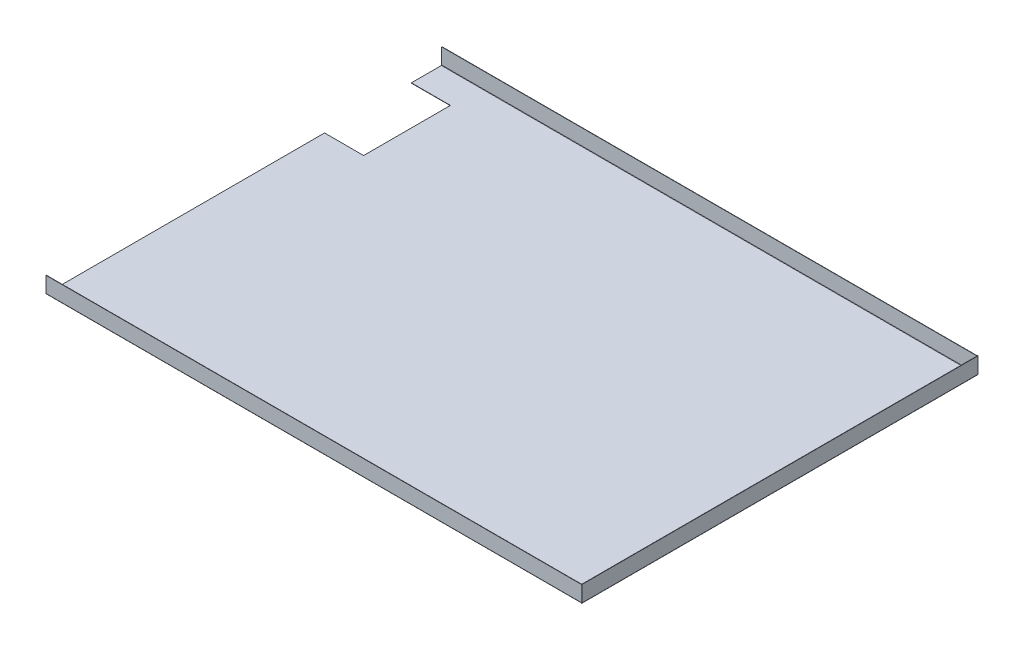
from build123d import *

# Parameters (mm, degrees)
BASE_FLANGE1_DEPTH             = 170
EDGE_FLANGE1_STRIP_W           = 0.762
EDGE_FLANGE1_STRIP_H           = 0.127
EDGE_FLANGE1_STRIP_CUT_DEPTH   = 229.873
EDGE_FLANGE1_STRIP_2_W         = 0.762
EDGE_FLANGE1_STRIP_2_H         = 0.127
EDGE_FLANGE1_STRIP_CUT_2_DEPTH = 229.873
EDGE_FLANGE1_DEPTH             = 229.873
EDGE_FLANGE1_BEND_DEPTH        = 229.873
SKETCH19_W                     = 16.773112734
SKETCH19_H                     = 37.266497541
CUT_EXTRUDE1_DEPTH             = 10


# Sheet-metal steps are written as plain solids
with BuildPart() as part:
    # Sketch1 → Base-Flange1 (new body)
    with BuildSketch(Plane.XY):
        with BuildLine():
            Line((0, 0), (229.873, 0))
            ThreePointArc((229.873, 0), (229.962802561, 0.037197439), (230, 0.127))
            Line((230, 0.127), (230, 7))
            Line((230, 7), (230.127, 7))
            Line((230.127, 7), (230.127, 0.127))
            ThreePointArc((230.127, 0.127), (230.052605122, -0.052605122), (229.873, -0.127))
            Line((229.873, -0.127), (0, -0.127))
            Line((0, -0.127), (0, 0))
        make_face()
    extrude(amount=BASE_FLANGE1_DEPTH)

    # Edge-Flange1 strip (across the edge) → Edge-Flange1 strip cut (cut)
    with BuildSketch(Plane.ZY.offset(-229.873)):
        with Locations((-0.127, -0.0635)):
            Rectangle(EDGE_FLANGE1_STRIP_W, EDGE_FLANGE1_STRIP_H)
    extrude(amount=EDGE_FLANGE1_STRIP_CUT_DEPTH, mode=Mode.SUBTRACT)

    # Edge-Flange1 strip 2 (across the edge) → Edge-Flange1 strip cut 2 (cut)
    with BuildSketch(Plane(origin=(0, 0, 170), x_dir=(0, 0, -1), z_dir=(1, 0, 0))):
        with Locations((-0.127, -0.0635)):
            Rectangle(EDGE_FLANGE1_STRIP_2_W, EDGE_FLANGE1_STRIP_2_H)
    extrude(amount=EDGE_FLANGE1_STRIP_CUT_2_DEPTH, mode=Mode.SUBTRACT)

    # Edge-Flange1 section (across the edge) → Edge-Flange1 (add)
    with BuildSketch(Plane.ZY.offset(-229.873)):
        with BuildLine():
            Line((0, 0.127), (0, 6.873))
            Line((0, 6.873), (0.127, 6.873))
            Line((0.127, 6.873), (0.127, 0.127))
            ThreePointArc((0.127, 0.127), (0.164197439, 0.037197439), (0.254, 0))
            Line((0.254, 0), (0.254, -0.127))
            ThreePointArc((0.254, -0.127), (0.074394878, -0.052605122), (0, 0.127))
        make_face()
    extrude(amount=EDGE_FLANGE1_DEPTH)

    # Edge-Flange1 section 2 (across the edge) → Edge-Flange1 bend (add)
    with BuildSketch(Plane(origin=(0, 0, 170), x_dir=(0, 0, -1), z_dir=(1, 0, 0))):
        with BuildLine():
            Line((0, 0.127), (0, 6.873))
            Line((0, 6.873), (0.127, 6.873))
            Line((0.127, 6.873), (0.127, 0.127))
            ThreePointArc((0.127, 0.127), (0.164197439, 0.037197439), (0.254, 0))
            Line((0.254, 0), (0.254, -0.127))
            ThreePointArc((0.254, -0.127), (0.074394878, -0.052605122), (0, 0.127))
        make_face()
    extrude(amount=EDGE_FLANGE1_BEND_DEPTH)

    # Sketch19 → Cut-Extrude1 (cut)
    with BuildSketch(Plane(origin=(0, 0, 0), x_dir=(1, 0, 0), z_dir=(0, 1, 0))):
        with Locations((8.386556367, -31.778783199)):
            Rectangle(SKETCH19_W, SKETCH19_H)
    extrude(amount=-CUT_EXTRUDE1_DEPTH, mode=Mode.SUBTRACT)


solid = part.part
